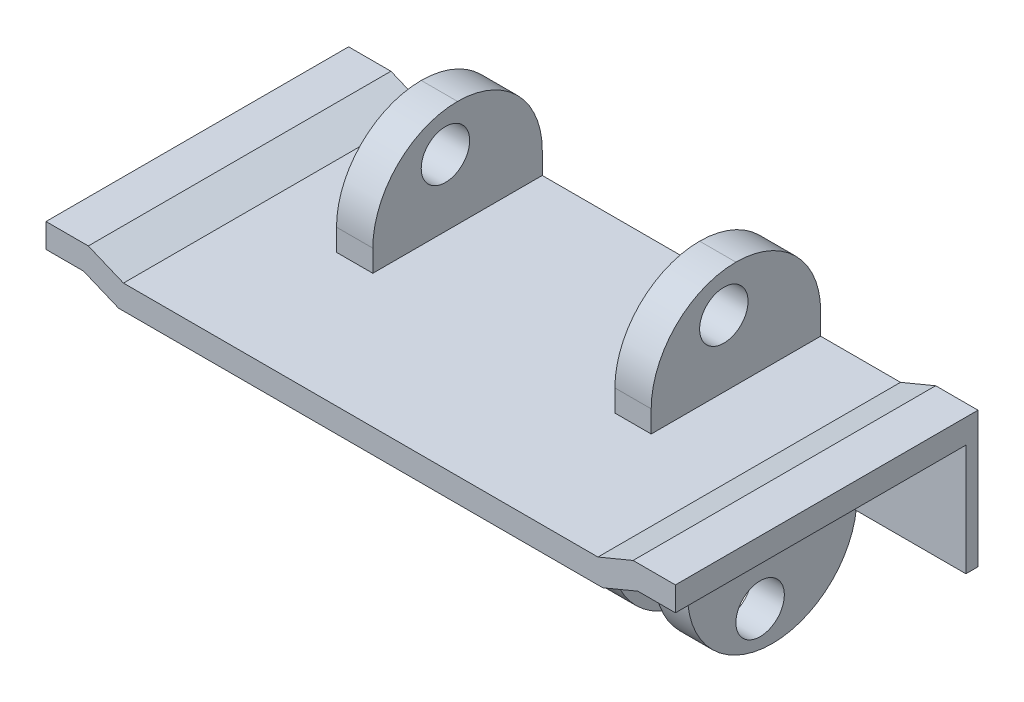
from build123d import *

# Parameters (mm, degrees)
SKETCH2_W                 = 5
SKETCH2_H                 = 15
BOSS_EXTRUDE1_DEPTH       = 14
BOSS_EXTRUDE1_2_DEPTH     = 14
BOSS_EXTRUDE3_DEPTH       = 25
SKETCH5_W                 = 3
SKETCH5_H                 = 8.8
BOSS_EXTRUDE4_DEPTH       = 14
SKETCH7_W                 = 3
SKETCH7_H                 = 15
BOSS_EXTRUDE5_DEPTH       = 14
SKETCH15_W                = 0.3
SKETCH15_H                = 14
CUT_EXTRUDE2_DEPTH        = 15
SKETCH16_W                = 0.15
SKETCH16_H                = 14
CUT_EXTRUDE3_DEPTH        = 15
FILLET1_R                 = 7
F_4_0MM_DOWEL_HOLE2_D     = 4
FILLET2_R                 = 7
F_4_0MM_DOWEL_HOLE1_D     = 4
F_4_0MM_DOWEL_HOLE1_DEPTH = 26
F_4_0MM_DOWEL_HOLE1_TIP   = 1.201721238
BOSS_EXTRUDE6_DEPTH       = 1
CUT_EXTRUDE4_DEPTH        = 2.4


with BuildPart() as part:
    # Sketch2 → Boss-Extrude1 (new body)
    with BuildSketch(Plane.XY):
        with Locations((-7.5, -1.5)):
            Rectangle(SKETCH2_W, SKETCH2_H)
    extrude(amount=BOSS_EXTRUDE1_DEPTH)



with BuildPart() as body_2:
    # Sketch2 → Boss-Extrude1 2 (new body)
    with BuildSketch(Plane.XY):
        with Locations((7.5, -1.5)):
            Rectangle(SKETCH2_W, SKETCH2_H)
    extrude(amount=BOSS_EXTRUDE1_2_DEPTH)


with BuildPart() as part_1:
    add(part.part)

    add(body_2.part)  # Boss-Extrude3 merges body 2
    # Sketch4 → Boss-Extrude3 (add)
    with BuildSketch(Plane.XY):
        Polygon((-10, 6), (-20, 6), (-22.901603942, 7.206366686), (-26, 7.206366686), (-26, 9.206366686), (-22.502408858, 9.206366686), (-19.600804916, 8), (-10, 8), (10, 8), (19.600804916, 8), (22.502408858, 9.206366686), (26, 9.206366686), (26, 7.206366686), (22.901603942, 7.206366686), (20, 6), (10, 6), align=None)
    extrude(amount=BOSS_EXTRUDE3_DEPTH)

    # Sketch5 → Boss-Extrude4 (add)
    with BuildSketch(Plane.XY):
        with Locations((-11.5, 12.4)):
            Rectangle(SKETCH5_W, SKETCH5_H)
        with Locations((11.5, 12.4)):
            Rectangle(SKETCH5_W, SKETCH5_H)
    extrude(amount=BOSS_EXTRUDE4_DEPTH)

    # Sketch7 → Boss-Extrude5 (add)
    with BuildSketch(Plane.XY):
        with Locations((-14.5, -1.5)):
            Rectangle(SKETCH7_W, SKETCH7_H)
        with Locations((14.5, -1.5)):
            Rectangle(SKETCH7_W, SKETCH7_H)
    extrude(amount=BOSS_EXTRUDE5_DEPTH)

    # Sketch15 → Cut-Extrude2 (cut)
    with BuildSketch(Plane.XZ.offset(9)):
        with Locations((-9.85, 7)):
            Rectangle(SKETCH15_W, SKETCH15_H)
        with Locations((9.85, 7)):
            Rectangle(SKETCH15_W, SKETCH15_H)
        with Locations((-13.15, 7)):
            Rectangle(SKETCH15_W, SKETCH15_H)
        with Locations((13.15, 7)):
            Rectangle(SKETCH15_W, SKETCH15_H)
    extrude(amount=-CUT_EXTRUDE2_DEPTH, mode=Mode.SUBTRACT)

    # Sketch16 → Cut-Extrude3 (cut)
    with BuildSketch(Plane.XZ.offset(9)):
        with Locations((-5.075, 7)):
            Rectangle(SKETCH16_W, SKETCH16_H)
        with Locations((5.075, 7)):
            Rectangle(SKETCH16_W, SKETCH16_H)
    extrude(amount=-CUT_EXTRUDE3_DEPTH, mode=Mode.SUBTRACT)

    # Fillet1
    fillet1_edges = [part_1.edges().sort_by_distance(p)[0] for p in [
        (7.425, -9, 0),
        (7.425, -9, 14),
        (-7.425, -9, 0),
        (-7.425, -9, 14),
        (-14.65, -9, 0),
        (-14.65, -9, 14),
        (14.65, -9, 14),
        (14.65, -9, 0),
    ]]
    fillet(fillet1_edges, radius=FILLET1_R - 0.0001)  # a hair under: the kernel refuses the full size

    # Ø4.0mm Dowel Hole2 (through all)
    with Locations(Plane(origin=(16, 0, 0), x_dir=(0, 0, -1), z_dir=(1, 0, 0))):
        with Locations((-8, -6)):
            Hole(F_4_0MM_DOWEL_HOLE2_D / 2)

    # Fillet2
    fillet2_edges = [part_1.edges().sort_by_distance(p)[0] for p in [
        (-11.5, 16.8, 0),
        (-11.5, 16.8, 14),
        (11.5, 16.8, 0),
        (11.5, 16.8, 14),
    ]]
    fillet(fillet2_edges, radius=FILLET2_R - 0.0001)  # a hair under: the kernel refuses the full size

    # Ø4.0mm Dowel Hole1
    with Locations(Plane(origin=(13, 0, 0), x_dir=(0, 0, -1), z_dir=(1, 0, 0))):
        with Locations((-8, 13.5)):
            Hole(F_4_0MM_DOWEL_HOLE1_D / 2, depth=F_4_0MM_DOWEL_HOLE1_DEPTH)
            with Locations((0, 0, -(F_4_0MM_DOWEL_HOLE1_DEPTH + F_4_0MM_DOWEL_HOLE1_TIP / 2))):  # 118° drill point
                Cone(0, F_4_0MM_DOWEL_HOLE1_D / 2, F_4_0MM_DOWEL_HOLE1_TIP, mode=Mode.SUBTRACT)

    # Sketch14 → Boss-Extrude6 (add)
    with BuildSketch(Plane.XY):
        Polygon((-22.901603942, 7.206366686), (-26, 7.206366686), (-26, -2), (-16, -2), (-16, 6), (-20, 6), align=None)
        Polygon((20, 6), (16, 6), (16, -2), (26, -2), (26, 7.206366686), (22.901603942, 7.206366686), align=None)
    extrude(amount=BOSS_EXTRUDE6_DEPTH)

    # Sketch18 → Cut-Extrude4 (cut)
    with BuildSketch(Plane(origin=(-5.15, 0, 0), x_dir=(0, 0, -1), z_dir=(1, 0, 0))):
        Polygon((-6.110899152, -3.235107358), (-9.449916842, -2.981544355), (-11.33901769, -5.746436996), (-12.466071308, -20.587923763), (-5.788035927, -21.095049771), (-4.66098231, -6.253563004), align=None)
    cut_extrude4 = extrude(amount=-CUT_EXTRUDE4_DEPTH, mode=Mode.SUBTRACT)

    # Mirror1: Cut-Extrude4 across plane
    add(cut_extrude4.mirror(Plane(origin=(0, 0, 0), x_dir=(0, 0, 1), z_dir=(1, 0, 0))), mode=Mode.SUBTRACT)


solid = part_1.part
